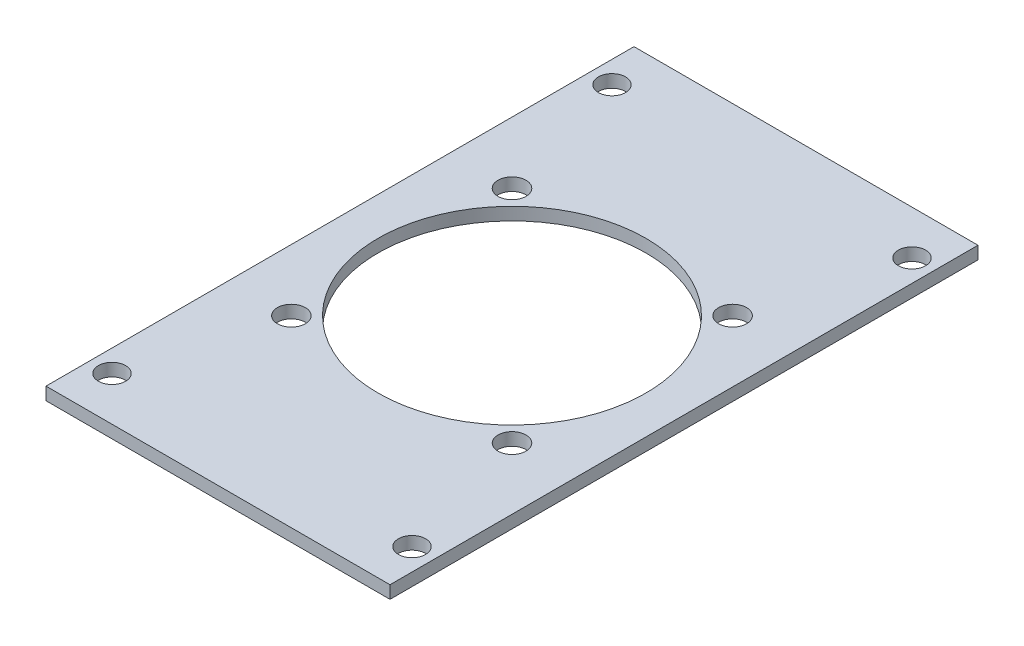
from build123d import *

# Parameters (mm, degrees)
SKETCH1_W           = 86
SKETCH1_H           = 147
SKETCH1_R           = 33.5
SKETCH1_R_2         = 3.4
BOSS_EXTRUDE1_DEPTH = 3.175
SKETCH2_R           = 3.5
CUT_EXTRUDE1_DEPTH  = 10


with BuildPart() as part:
    # Sketch1 → Boss-Extrude1 (new body)
    with BuildSketch(Plane(origin=(0, 0, 0), x_dir=(1, 0, 0), z_dir=(0, 1, 0))):
        Rectangle(SKETCH1_W, SKETCH1_H)
        Circle(SKETCH1_R, mode=Mode.SUBTRACT)
        with Locations((-37.5, -62.5)):
            Circle(SKETCH1_R_2, mode=Mode.SUBTRACT)
        with Locations((37.5, -62.5)):
            Circle(SKETCH1_R_2, mode=Mode.SUBTRACT)
        with Locations((-37.5, 62.5)):
            Circle(SKETCH1_R_2, mode=Mode.SUBTRACT)
        with Locations((37.5, 62.5)):
            Circle(SKETCH1_R_2, mode=Mode.SUBTRACT)
    extrude(amount=BOSS_EXTRUDE1_DEPTH)

    # Sketch2 → Cut-Extrude1 (cut)
    with BuildSketch(Plane(origin=(0, 3.175, 0), x_dir=(1, 0, 0), z_dir=(0, 1, 0))):
        with Locations((-27.577164466, 27.577164466)):
            Circle(SKETCH2_R)
        with Locations((27.577164466, 27.577164466)):
            Circle(SKETCH2_R)
        with Locations((27.577164466, -27.577164466)):
            Circle(SKETCH2_R)
        with Locations((-27.577164466, -27.577164466)):
            Circle(SKETCH2_R)
    extrude(amount=-CUT_EXTRUDE1_DEPTH, mode=Mode.SUBTRACT)


solid = part.part
